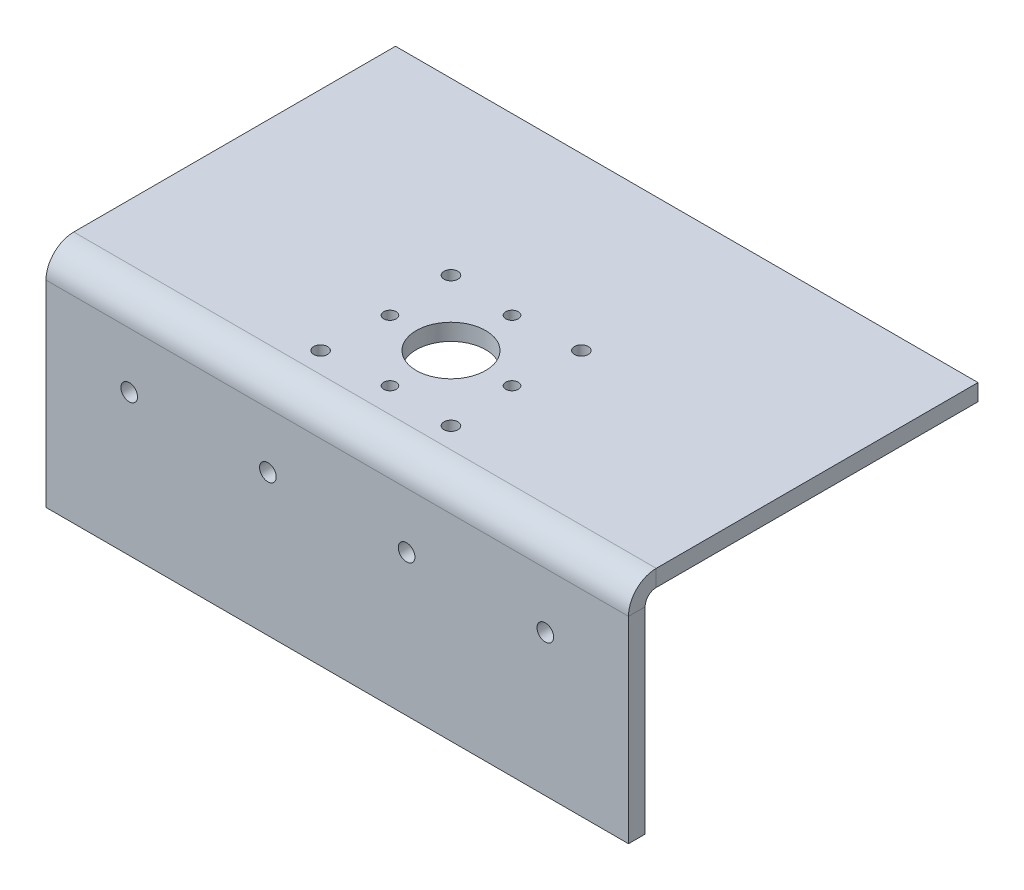
from build123d import *

# Parameters (mm, degrees)
BASE_FLANGE1_DEPTH = 105
SKETCH6_R          = 12.5
SKETCH6_R_2        = 2.5
CUT_EXTRUDE1_DEPTH = 10
SKETCH7_R          = 3
CUT_EXTRUDE2_DEPTH = 10
SKETCH8_R          = 2.25
CUT_EXTRUDE3_DEPTH = 10


# Sheet-metal steps are written as plain solids
with BuildPart() as part:
    # Sketch1 → Base-Flange1 (new, symmetric)
    with BuildSketch(Plane(origin=(0, 0, 0), x_dir=(0, 0, -1), z_dir=(1, 0, 0))):
        with BuildLine():
            Line((0, -75), (0, -4))
            ThreePointArc((0, -4), (1.171572875, -1.171572875), (4, 0))
            Line((4, 0), (120, 0))
            Line((120, 0), (120, 6))
            Line((120, 6), (4, 6))
            ThreePointArc((4, 6), (-3.071067812, 3.071067812), (-6, -4))
            Line((-6, -4), (-6, -75))
            Line((-6, -75), (0, -75))
        make_face()
    extrude(amount=BASE_FLANGE1_DEPTH, both=True)

    # Sketch6 → Cut-Extrude1 (cut)
    with BuildSketch(Plane(origin=(0, 6, 0), x_dir=(1, 0, 0), z_dir=(0, 1, 0))):
        with Locations(Location((0, 35, 0), (0, 0, 270))):
            Circle(SKETCH6_R)
        with Locations(Location((23.5, 58.5, 0), (0, 0, 270))):
            Circle(SKETCH6_R_2)
        with Locations(Location((-23.5, 58.5, 0), (0, 0, 270))):
            Circle(SKETCH6_R_2)
        with Locations(Location((-23.5, 11.5, 0), (0, 0, 270))):
            Circle(SKETCH6_R_2)
        with Locations(Location((23.5, 11.5, 0), (0, 0, 270))):
            Circle(SKETCH6_R_2)
    extrude(amount=-CUT_EXTRUDE1_DEPTH, mode=Mode.SUBTRACT)

    # Sketch7 → Cut-Extrude2 (cut)
    with BuildSketch(Plane.XY.offset(6)):
        with Locations((-75, -24)):
            Circle(SKETCH7_R)
        with Locations((-25, -24)):
            Circle(SKETCH7_R)
        with Locations((25, -24)):
            Circle(SKETCH7_R)
        with Locations((75, -24)):
            Circle(SKETCH7_R)
    extrude(amount=-CUT_EXTRUDE2_DEPTH, mode=Mode.SUBTRACT)

    # Sketch8 → Cut-Extrude3 (cut)
    with BuildSketch(Plane(origin=(0, 6, 0), x_dir=(1, 0, 0), z_dir=(0, 1, 0))):
        with Locations(Location((0, 13, 0), (0, 0, 270))):
            Circle(SKETCH8_R)
        with Locations(Location((-22, 35, 0), (0, 0, 270))):
            Circle(SKETCH8_R)
        with Locations(Location((0, 57, 0), (0, 0, 270))):
            Circle(SKETCH8_R)
        with Locations(Location((22, 35, 0), (0, 0, 270))):
            Circle(SKETCH8_R)
    extrude(amount=-CUT_EXTRUDE3_DEPTH, mode=Mode.SUBTRACT)


solid = part.part
